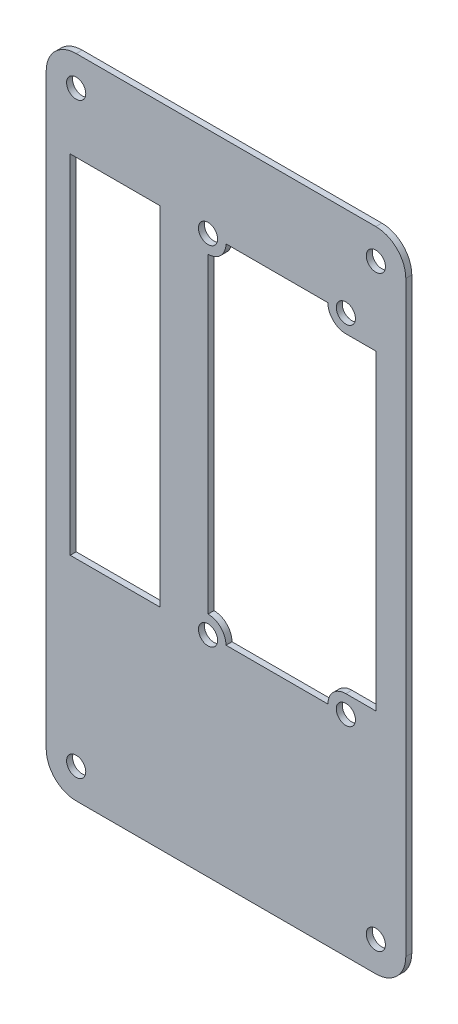
from build123d import *

# Parameters (mm, degrees)
SKETCH_1_W          = 60
SKETCH_1_H          = 108
EXTRUDE_1_DEPTH     = 1
SKETCH_2_R          = 1.6
CUT_EXTRUDE_1_DEPTH = 5
CUT_EXTRUDE_2_DEPTH = 5
SKETCH_4_R          = 1.6
CUT_EXTRUDE_3_DEPTH = 5
SKETCH_5_W          = 5
SKETCH_5_H          = 52
CUT_EXTRUDE_4_DEPTH = 10
SKETCH_6_W          = 15
SKETCH_6_H          = 58
CUT_EXTRUDE_5_DEPTH = 10
FILLET_1_R          = 5


with BuildPart() as part:
    # ｽｹｯﾁ1 → ﾎﾞｽ - 押し出し1 (new body)
    with BuildSketch(Plane.XY):
        Rectangle(SKETCH_1_W, SKETCH_1_H)
    extrude(amount=EXTRUDE_1_DEPTH)

    # ｽｹｯﾁ2 → ｶｯﾄ - 押し出し1 (cut)
    with BuildSketch(Plane.XY.offset(1)):
        with Locations((-3, 39)):
            Circle(SKETCH_2_R)
        with Locations((20, 39)):
            Circle(SKETCH_2_R)
        with Locations((-3, -19)):
            Circle(SKETCH_2_R)
        with Locations((20, -19)):
            Circle(SKETCH_2_R)
    extrude(amount=-CUT_EXTRUDE_1_DEPTH, mode=Mode.SUBTRACT)

    # ｽｹｯﾁ3 → ｶｯﾄ - 押し出し2 (cut)
    with BuildSketch(Plane.XY.offset(1)):
        with BuildLine():
            Line((17, 39), (0, 39))
            ThreePointArc((0, 39), (-0.878679656, 36.878679656), (-3, 36))
            Line((-3, 36), (-3, -16))
            ThreePointArc((-3, -16), (-0.878679656, -16.878679656), (0, -19))
            Line((0, -19), (17, -19))
            ThreePointArc((17, -19), (17.878679656, -16.878679656), (20, -16))
            Line((20, -16), (20, 36))
            ThreePointArc((20, 36), (17.878679656, 36.878679656), (17, 39))
        make_face()
    extrude(amount=-CUT_EXTRUDE_2_DEPTH, mode=Mode.SUBTRACT)

    # ｽｹｯﾁ4 → ｶｯﾄ - 押し出し3 (cut)
    with BuildSketch(Plane.XY.offset(1)):
        with Locations((-25, 49)):
            Circle(SKETCH_4_R)
        with Locations((25, 49)):
            Circle(SKETCH_4_R)
        with Locations((-25, -49)):
            Circle(SKETCH_4_R)
        with Locations((25, -49)):
            Circle(SKETCH_4_R)
    extrude(amount=-CUT_EXTRUDE_3_DEPTH, mode=Mode.SUBTRACT)

    # ｽｹｯﾁ5 → ｶｯﾄ - 押し出し4 (cut)
    with BuildSketch(Plane.XY.offset(1)):
        with Locations((22.5, 10)):
            Rectangle(SKETCH_5_W, SKETCH_5_H)
    extrude(amount=-CUT_EXTRUDE_4_DEPTH, mode=Mode.SUBTRACT)

    # ｽｹｯﾁ6 → ｶｯﾄ - 押し出し5 (cut)
    with BuildSketch(Plane.XY.offset(1)):
        with Locations((-18.5, 10)):
            Rectangle(SKETCH_6_W, SKETCH_6_H)
    extrude(amount=-CUT_EXTRUDE_5_DEPTH, mode=Mode.SUBTRACT)

    # ﾌｨﾚｯﾄ1
    fillet_1_edges = [part.edges().sort_by_distance(p)[0] for p in [
        (30, -54, 0.5),
        (-30, -54, 0.5),
        (-30, 54, 0.5),
        (30, 54, 0.5),
    ]]
    fillet(fillet_1_edges, radius=FILLET_1_R)


solid = part.part
